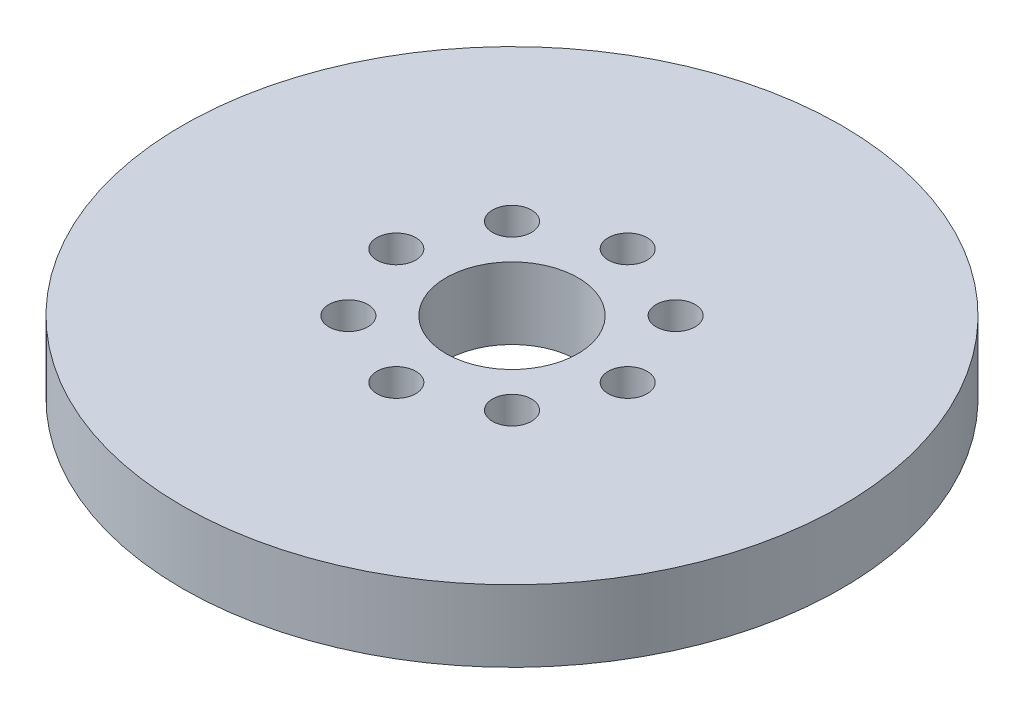
from build123d import *

# Parameters (mm, degrees)
SKETCH1_R           = 87.5
BOSS_EXTRUDE1_DEPTH = 19
SKETCH2_R           = 17.5
CUT_EXTRUDE1_DEPTH  = 126.193849689
SKETCH3_R           = 5.170987345
CUT_EXTRUDE2_DEPTH  = 13.948918479
CIRPATTERN1_COUNT   = 8


with BuildPart() as part:
    # Sketch1 → Boss-Extrude1 (new body)
    with BuildSketch(Plane(origin=(0, 0, 0), x_dir=(1, 0, 0), z_dir=(0, 1, 0))):
        Circle(SKETCH1_R)
    extrude(amount=BOSS_EXTRUDE1_DEPTH)

    # Sketch2 → Cut-Extrude1 (cut, through all)
    with BuildSketch(Plane(origin=(0, 0, 0), x_dir=(1, 0, 0), z_dir=(0, 1, 0))):
        Circle(SKETCH2_R)
    extrude(amount=CUT_EXTRUDE1_DEPTH, mode=Mode.SUBTRACT)

    # Sketch3 → Cut-Extrude2 (cut)
    with BuildSketch(Plane(origin=(0, 19, 0), x_dir=(1, 0, 0), z_dir=(0, 1, 0))):
        with Locations((-30.719546179, 0)):
            Circle(SKETCH3_R)
    cut_extrude2 = extrude(amount=-CUT_EXTRUDE2_DEPTH, mode=Mode.SUBTRACT)

    # CirPattern1: Cut-Extrude2 ×8 about axis
    cirpattern1_axis = Axis((0, 0, 0), (0, 1, 0))
    for i in range(1, CIRPATTERN1_COUNT):
        add(cut_extrude2.rotate(cirpattern1_axis, i * 360 / CIRPATTERN1_COUNT), mode=Mode.SUBTRACT)


solid = part.part
